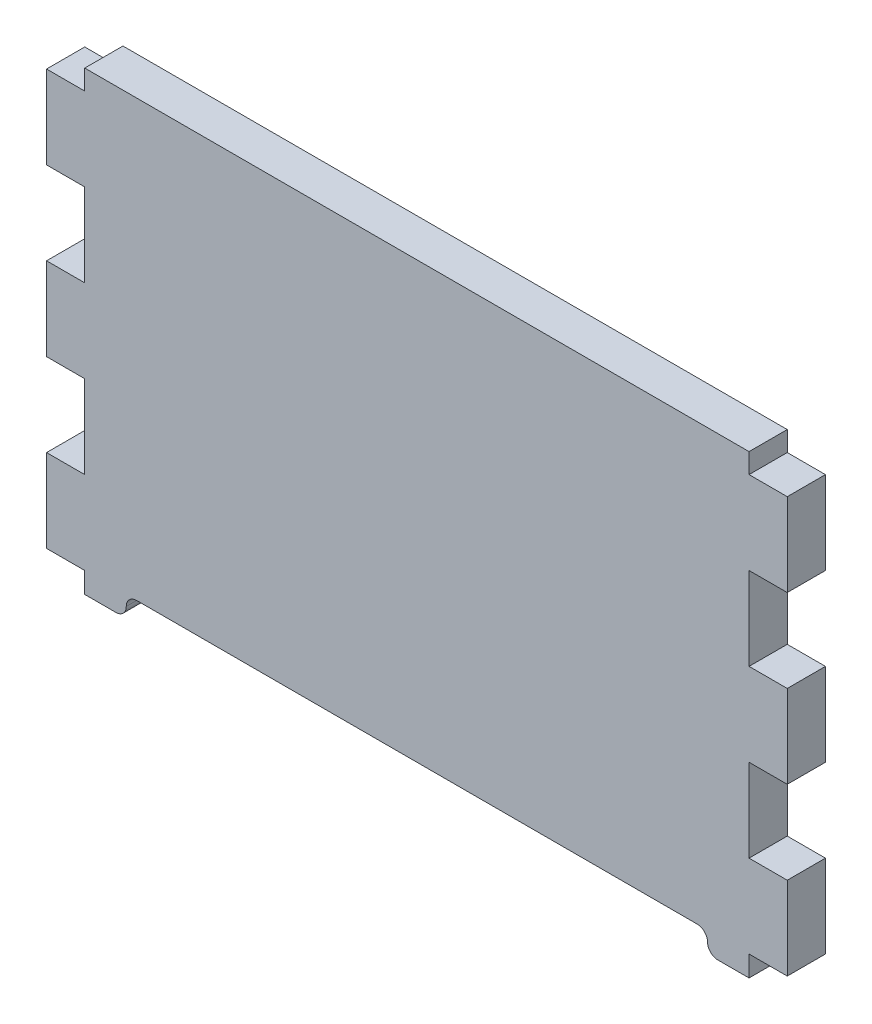
from build123d import *

# Parameters (mm, degrees)
BOSS_EXTRUDE1_DEPTH = 5.842
FILLET1_R           = 1.5875


with BuildPart() as part:
    # Sketch1 → Boss-Extrude1 (new body)
    with BuildSketch(Plane.XY):
        Polygon((50.8, -22.225), (44.45, -22.225), (44.45, -19.05), (-44.45, -19.05), (-44.45, -22.225), (-50.8, -22.225), (-50.8, -19.05), (-56.642, -19.05), (-56.642, -6.35), (-50.8, -6.35), (-50.8, 6.35), (-56.642, 6.35), (-56.642, 19.05), (-50.8, 19.05), (-50.8, 31.75), (-56.642, 31.75), (-56.642, 44.45), (-50.8, 44.45), (-50.8, 47.498), (50.8, 47.498), (50.8, 44.45), (56.642, 44.45), (56.642, 31.75), (50.8, 31.75), (50.8, 19.05), (56.642, 19.05), (56.642, 6.35), (50.8, 6.35), (50.8, -6.35), (56.642, -6.35), (56.642, -19.05), (50.8, -19.05), align=None)
    extrude(amount=BOSS_EXTRUDE1_DEPTH)

    # Fillet1
    fillet1_edges = [part.edges().sort_by_distance(p)[0] for p in [
        (-44.45, -19.05, 2.921),
        (44.45, -19.05, 2.921),
    ]]
    fillet(fillet1_edges, radius=FILLET1_R)
    fillet1_2_edges = [part.edges().sort_by_distance(p)[0] for p in [
        (44.45, -22.225, 2.921),
        (-44.45, -22.225, 2.921),
    ]]
    fillet(fillet1_2_edges, radius=FILLET1_R - 0.0001)  # a hair under: the kernel refuses the full size


solid = part.part
